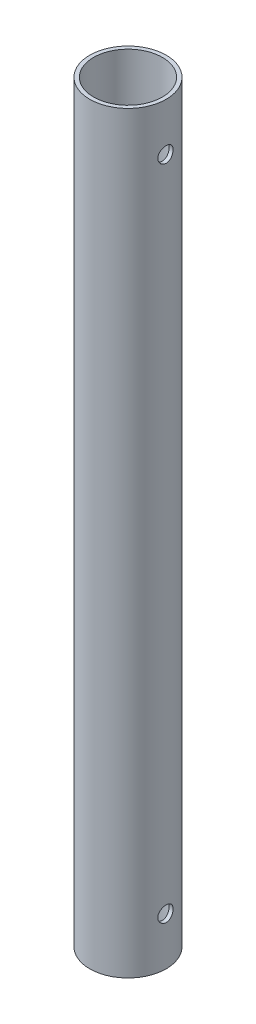
from build123d import *

# Parameters (mm, degrees)
SKETCH1_R           = 10
SKETCH1_R_2         = 9
BOSS_EXTRUDE1_DEPTH = 197
CUT_EXTRUDE1_DEPTH  = 199.264974214


with BuildPart() as part:
    # Sketch1 → Boss-Extrude1 (new body)
    with BuildSketch(Plane(origin=(0, 0, 0), x_dir=(1, 0, 0), z_dir=(0, 1, 0))):
        Circle(SKETCH1_R)
        Circle(SKETCH1_R_2, mode=Mode.SUBTRACT)
    extrude(amount=BOSS_EXTRUDE1_DEPTH)

    # Sketch2 → Cut-Extrude1 (cut, through all)
    with BuildSketch(Plane(origin=(10, 0, 0), x_dir=(0, 0, -1), z_dir=(1, 0, 0))):
        with BuildLine():
            ThreePointArc((2, 184.5), (1.414213562, 185.914213562), (0, 186.5))
            Line((0, 186.5), (0, 182.5))
            ThreePointArc((0, 182.5), (1.414213562, 183.085786438), (2, 184.5))
        make_face()
        with BuildLine():
            Line((0, 182.5), (0, 186.5))
            ThreePointArc((0, 186.5), (-2, 184.5), (0, 182.5))
        make_face()
        with BuildLine():
            ThreePointArc((2, 12.5), (1.414213562, 13.914213562), (0, 14.5))
            Line((0, 14.5), (0, 10.5))
            ThreePointArc((0, 10.5), (1.414213562, 11.085786438), (2, 12.5))
        make_face()
        with BuildLine():
            Line((0, 10.5), (0, 14.5))
            ThreePointArc((0, 14.5), (-2, 12.5), (0, 10.5))
        make_face()
        with BuildLine():
            ThreePointArc((2, 12.5), (1.414213562, 13.914213562), (0, 14.5))
            Line((0, 14.5), (0, 10.5))
            ThreePointArc((0, 10.5), (1.414213562, 11.085786438), (2, 12.5))
        make_face()
        with BuildLine():
            Line((0, 10.5), (0, 14.5))
            ThreePointArc((0, 14.5), (-2, 12.5), (0, 10.5))
        make_face()
        with BuildLine():
            ThreePointArc((2, 184.5), (1.414213562, 185.914213562), (0, 186.5))
            Line((0, 186.5), (0, 182.5))
            ThreePointArc((0, 182.5), (1.414213562, 183.085786438), (2, 184.5))
        make_face()
        with BuildLine():
            Line((0, 182.5), (0, 186.5))
            ThreePointArc((0, 186.5), (-2, 184.5), (0, 182.5))
        make_face()
    extrude(amount=-CUT_EXTRUDE1_DEPTH, mode=Mode.SUBTRACT)


solid = part.part
